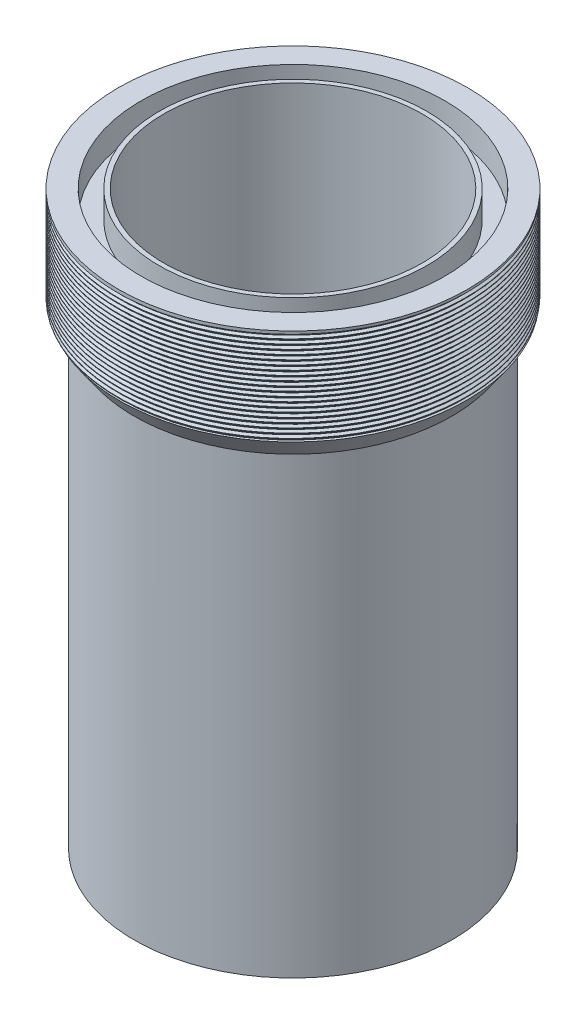
from build123d import *
from build123d.topology import SkipClean

# Parameters (mm, degrees)
THREAD2_PITCH = 1


with BuildPart() as part:
    # Sketch1 → Revolve1 (revolve)
    with BuildSketch(Plane.XY, mode=Mode.PRIVATE) as revolve1_sk:
        Polygon((0, 0), (28.5, 0), (28.5, 118), (29.5, 118), (29.5, 112), (33.5, 112), (33.5, 118), (38.5, 118), (38.5, 97), (35, 92), (35, -8), (0, -8), align=None)
    revolve(revolve1_sk.sketch.rotate(Axis((0, 0, 0), (0, 1, 0)), 90), axis=Axis((0, 0, 0), (0, 1, 0)))

    # Thread2: the profile of Thread Profile2 profile screwed along a right-hand helix of 21 turns, 8 arcs to a turn; built about Z, then put on its axis
    with SkipClean():  # the faces are left unmerged after this step: merging them gives an invalid solid
        thread2_z = Axis((0, 0, 0), (0, 0, 1))
        thread2_corners = [(38.5003, 0, -0.000173205), (38.5003, 0, 0.875173202), (37.958734125, 0, 0.562499999), (37.958734125, 0, 0.312499999)]
        with BuildLine(mode=Mode.PRIVATE) as thread2_profile:
            Line(thread2_corners[0], thread2_corners[1])
            Line(thread2_corners[1], thread2_corners[2])
            Line(thread2_corners[2], thread2_corners[3])
            Line(thread2_corners[3], thread2_corners[0])
        thread2_cap = Face(thread2_profile.wire())
        thread2_turn_angles = [0, 22.5, 45, 67.5, 90, 112.5, 135, 157.5, 180, 202.5, 225, 247.5, 270, 292.5, 315, 337.5, 360]
        thread2_turn_weights = [1, 0.9238795325112867, 1, 0.9238795325112867, 1, 0.9238795325112867, 1, 0.9238795325112867, 1, 0.9238795325112867, 1, 0.9238795325112867, 1, 0.9238795325112867, 1, 0.9238795325112867, 1]
        thread2_turn_rails = [Edge.make_bspline([Vector(p[0], p[1], 0).rotate(thread2_z, thread2_turn_angles[k]) / thread2_turn_weights[k] + Vector(0, 0, p[2] + THREAD2_PITCH * thread2_turn_angles[k] / 360) for k in range(17)], [0, 0, 0, 1, 1, 2, 2, 3, 3, 4, 4, 5, 5, 6, 6, 7, 7, 8, 8, 8], 2, thread2_turn_weights) for p in thread2_corners]
        thread2_turn_sides = [Face.make_surface_from_curves(thread2_turn_rails[p[0]], thread2_turn_rails[p[1]]) for p in [(0, 1), (1, 2), (2, 3), (3, 0)]]
        thread2 = Plane(origin=(0, 118, 0), x_dir=(-1, 0, 0), z_dir=(0, -1, 0)) * Solid(Shell([*[p.moved(Location((0, 0, THREAD2_PITCH * i))) for i in range(21) for p in thread2_turn_sides], thread2_cap, thread2_cap.rotate(thread2_z, 7560).moved(Location((0, 0, THREAD2_PITCH * 7560 / 360)))]))
        add(thread2, mode=Mode.SUBTRACT)


solid = part.part
